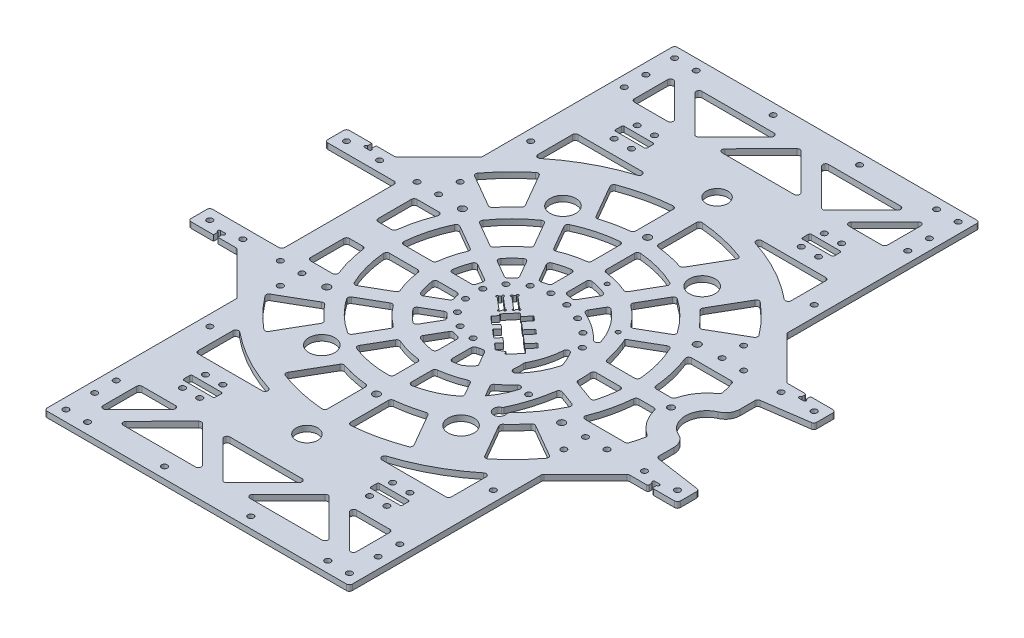
from build123d import *

# Parameters (mm, degrees)
EXTRUDE_2_OUTLINE_R   = 135
EXTRUDE_2_OUTLINE_R_2 = 2
EXTRUDE_2_DEPTH       = 4
SKETCH_7_R            = 2.5
SKETCH_7_R_2          = 1.5
CUT_EXTRUDE_3_DEPTH   = 191.960728947
EXTRUDE_START         = -4
SKETCH_8_R            = 135
EXTRUDE_3_DEPTH       = 4
SKETCH_9_R            = 0.75
SKETCH_9_R_2          = 2
SKETCH_9_R_3          = 2.2
SKETCH_9_W            = 22
SKETCH_9_H            = 6
SKETCH_9_W_2          = 3
SKETCH_9_H_2          = 5
SKETCH_9_W_3          = 50
SKETCH_9_H_3          = 80
CUT_EXTRUDE_4_DEPTH   = 278.267019315
FILLET_1_R            = 0.5
SKETCH_10_R           = 9
SKETCH_10_R_2         = 1
CUT_EXTRUDE_5_DEPTH   = 278.267019315
SKETCH_12_W           = 10
SKETCH_12_H           = 55
SKETCH_12_W_2         = 30
SKETCH_12_H_2         = 10
SKETCH_12_W_3         = 55
EXTRUDE_2_2_DEPTH     = 4
SKETCH_22_R           = 7.5
SKETCH_22_R_2         = 4
CUT_EXTRUDE_10_DEPTH  = 278.267019315
FILLET_2_R            = 2
FILLET_3_R            = 1
FILLET_5_R            = 2


with BuildPart() as part:
    # Extrude 2: read off the stored shape, not the designer's step
    # Extrude 2 outline → Extrude 2 (new body)
    with BuildSketch(Plane(origin=(0, 0, 0), x_dir=(1, 0, 0), z_dir=(0, 1, 0))):
        Circle(EXTRUDE_2_OUTLINE_R)
        with Locations((-11.714860956, -24.326159433)):
            Circle(EXTRUDE_2_OUTLINE_R_2, mode=Mode.SUBTRACT)
        with Locations((-21.109450027, -16.83422465)):
            Circle(EXTRUDE_2_OUTLINE_R_2, mode=Mode.SUBTRACT)
        with Locations((-26.323053629, -6.008065217)):
            Circle(EXTRUDE_2_OUTLINE_R_2, mode=Mode.SUBTRACT)
        with Locations((53.170264489, -41.583325675)):
            Circle(EXTRUDE_2_OUTLINE_R_2, mode=Mode.SUBTRACT)
        with Locations((0, -27)):
            Circle(EXTRUDE_2_OUTLINE_R_2, mode=Mode.SUBTRACT)
        with Locations((-26.323053629, 6.008065217)):
            Circle(EXTRUDE_2_OUTLINE_R_2, mode=Mode.SUBTRACT)
        with Locations((-21.109450027, 16.83422465)):
            Circle(EXTRUDE_2_OUTLINE_R_2, mode=Mode.SUBTRACT)
        with Locations((-11.714860956, 24.326159433)):
            Circle(EXTRUDE_2_OUTLINE_R_2, mode=Mode.SUBTRACT)
        with Locations((0, 27)):
            Circle(EXTRUDE_2_OUTLINE_R_2, mode=Mode.SUBTRACT)
        with Locations((12.54040261, 25.523692772)):
            Circle(EXTRUDE_2_OUTLINE_R_2, mode=Mode.SUBTRACT)
        with Locations((24.405378999, 21.203563613)):
            Circle(EXTRUDE_2_OUTLINE_R_2, mode=Mode.SUBTRACT)
        with Locations((43.695920987, 5.163960602)):
            Circle(EXTRUDE_2_OUTLINE_R_2, mode=Mode.SUBTRACT)
        with Locations((34.975533599, 14.296102982)):
            Circle(EXTRUDE_2_OUTLINE_R_2, mode=Mode.SUBTRACT)
    extrude(amount=EXTRUDE_2_DEPTH)

    # 草图7 → 切除-拉伸3 (cut, through all)
    with BuildSketch(Plane(origin=(0, 4, 0), x_dir=(1, 0, 0), z_dir=(0, 1, 0))):
        with Locations(Location((81.622894307, 47.125, 0), (0, 0, 270))):
            Circle(SKETCH_7_R)
        with Locations(Location((81.622894307, -47.125, 0), (0, 0, 270))):
            Circle(SKETCH_7_R)
        with Locations(Location((0, -94.25, 0), (0, 0, 270))):
            Circle(SKETCH_7_R)
        with Locations(Location((-81.622894307, -47.125, 0), (0, 0, 270))):
            Circle(SKETCH_7_R)
        with Locations(Location((-81.622894307, 47.125, 0), (0, 0, 270))):
            Circle(SKETCH_7_R)
        with Locations(Location((0, 94.25, 0), (0, 0, 270))):
            Circle(SKETCH_7_R)
        with Locations(Location((13.976228436, 52.15999462, 0), (0, 0, 270))):
            Circle(SKETCH_7_R_2)
        with Locations(Location((46.765371804, 27, 0), (0, 0, 270))):
            Circle(SKETCH_7_R_2)
        Polygon((1.215567157, 4.509929222), (-5.400270312, -3.253491067), (20.858357137, -25.630588388), (27.474194606, -17.867168099), align=None)
        Polygon((-10.201227386, 14.23910197), (-12.147061936, 11.955743062), (-3.013626301, 4.172404863), (-1.067791752, 6.455763772), align=None)
        Polygon((-7.68362922, -1.307656517), (-5.737794671, 0.975702391), (-14.871230305, 8.75904059), (-16.817064855, 6.475681681), align=None)
    extrude(amount=-CUT_EXTRUDE_3_DEPTH, mode=Mode.SUBTRACT)

    # 草图8 → 凸台-拉伸3 (add)
    with BuildSketch(Plane(origin=(0, 4, 0), x_dir=(1, 0, 0), z_dir=(0, 1, 0)).offset(EXTRUDE_START)):
        Polygon((170, 55), (170, -55), (136, -55), (106, -85), (106, -219), (-106, -219), (-106, -85), (-136, -55), (-170, -55), (-170, 55), (-136, 55), (-106, 85), (-106, 219), (106, 219), (106, 85), (136, 55), align=None)
        Circle(SKETCH_8_R, mode=Mode.SUBTRACT)
    extrude(amount=EXTRUDE_3_DEPTH)

    # 草图9 → 切除-拉伸4 (cut, through all)
    with BuildSketch(Plane(origin=(0, 4, 0), x_dir=(1, 0, 0), z_dir=(0, 1, 0))):
        with Locations((-3.013626301, 4.172404863)):
            Circle(SKETCH_9_R)
        with Locations((-1.067791752, 6.455763772)):
            Circle(SKETCH_9_R)
        with Locations((-10.201227386, 14.23910197)):
            Circle(SKETCH_9_R)
        with Locations((-12.147061936, 11.955743062)):
            Circle(SKETCH_9_R)
        with Locations((-14.871230305, 8.75904059)):
            Circle(SKETCH_9_R)
        with Locations((-16.817064855, 6.475681681)):
            Circle(SKETCH_9_R)
        with Locations((-5.737794671, 0.975702391)):
            Circle(SKETCH_9_R)
        with Locations((-7.68362922, -1.307656517)):
            Circle(SKETCH_9_R)
        with Locations(Location((162.5, 47.5, 0), (0, 0, 270))):
            Circle(SKETCH_9_R_2)
        with Locations(Location((139.5, 47.5, 0), (0, 0, 270))):
            Circle(SKETCH_9_R_2)
        with Locations(Location((98.5, 62.5, 0), (0, 0, 270))):
            Circle(SKETCH_9_R_2)
        with Locations(Location((98.5, 47.5, 0), (0, 0, 270))):
            Circle(SKETCH_9_R_2)
        with Locations(Location((113.5, 47.5, 0), (0, 0, 270))):
            Circle(SKETCH_9_R_2)
        with Locations(Location((162.5, -47.5, 0), (0, 0, 90))):
            Circle(SKETCH_9_R_2)
        with Locations(Location((139.5, -47.5, 0), (0, 0, 90))):
            Circle(SKETCH_9_R_2)
        with Locations(Location((113.5, -47.5, 0), (0, 0, 90))):
            Circle(SKETCH_9_R_2)
        with Locations(Location((98.5, -47.5, 0), (0, 0, 90))):
            Circle(SKETCH_9_R_2)
        with Locations(Location((98.5, -62.5, 0), (0, 0, 90))):
            Circle(SKETCH_9_R_2)
        with Locations(Location((-98.5, -62.5, 0), (0, 0, 270))):
            Circle(SKETCH_9_R_2)
        with Locations(Location((-98.5, -47.5, 0), (0, 0, 270))):
            Circle(SKETCH_9_R_2)
        with Locations(Location((-113.5, -47.5, 0), (0, 0, 270))):
            Circle(SKETCH_9_R_2)
        with Locations(Location((-139.5, -47.5, 0), (0, 0, 270))):
            Circle(SKETCH_9_R_2)
        with Locations(Location((-162.5, -47.5, 0), (0, 0, 270))):
            Circle(SKETCH_9_R_2)
        with Locations(Location((-113.5, 47.5, 0), (0, 0, 90))):
            Circle(SKETCH_9_R_2)
        with Locations(Location((-98.5, 47.5, 0), (0, 0, 90))):
            Circle(SKETCH_9_R_2)
        with Locations(Location((-98.5, 62.5, 0), (0, 0, 90))):
            Circle(SKETCH_9_R_2)
        with Locations(Location((-139.5, 47.5, 0), (0, 0, 90))):
            Circle(SKETCH_9_R_2)
        with Locations(Location((-162.5, 47.5, 0), (0, 0, 90))):
            Circle(SKETCH_9_R_2)
        with Locations(Location((110.5, 0, 0), (0, 0, 270))):
            Circle(SKETCH_9_R_3)
        with Locations(Location((71, 158, 0), (0, 0, 270))):
            Circle(SKETCH_9_R_2)
        with Locations(Location((59, 158, 0), (0, 0, 270))):
            Circle(SKETCH_9_R_2)
        with Locations(Location((83.5, 211.5, 0), (0, 0, 270))):
            Circle(SKETCH_9_R_2)
        with Locations(Location((98.5, 211.5, 0), (0, 0, 270))):
            Circle(SKETCH_9_R_2)
        with Locations(Location((98.5, 191.5, 0), (0, 0, 270))):
            Circle(SKETCH_9_R_2)
        with Locations(Location((98.5, 176.5, 0), (0, 0, 270))):
            Circle(SKETCH_9_R_2)
        with Locations(Location((98.5, 111.5, 0), (0, 0, 270))):
            Circle(SKETCH_9_R_2)
        with Locations(Location((98.5, -111.5, 0), (0, 0, 90))):
            Circle(SKETCH_9_R_2)
        with Locations(Location((98.5, -176.5, 0), (0, 0, 90))):
            Circle(SKETCH_9_R_2)
        with Locations(Location((98.5, -191.5, 0), (0, 0, 90))):
            Circle(SKETCH_9_R_2)
        with Locations(Location((98.5, -211.5, 0), (0, 0, 90))):
            Circle(SKETCH_9_R_2)
        with Locations(Location((83.5, -211.5, 0), (0, 0, 90))):
            Circle(SKETCH_9_R_2)
        with Locations(Location((-98.5, 111.5, 0), (0, 0, 90))):
            Circle(SKETCH_9_R_2)
        with Locations(Location((-98.5, 176.5, 0), (0, 0, 90))):
            Circle(SKETCH_9_R_2)
        with Locations(Location((-98.5, 191.5, 0), (0, 0, 90))):
            Circle(SKETCH_9_R_2)
        with Locations(Location((-98.5, 211.5, 0), (0, 0, 90))):
            Circle(SKETCH_9_R_2)
        with Locations(Location((-83.5, 211.5, 0), (0, 0, 90))):
            Circle(SKETCH_9_R_2)
        with Locations(Location((-83.5, -211.5, 0), (0, 0, 270))):
            Circle(SKETCH_9_R_2)
        with Locations(Location((-98.5, -211.5, 0), (0, 0, 270))):
            Circle(SKETCH_9_R_2)
        with Locations(Location((-98.5, -191.5, 0), (0, 0, 270))):
            Circle(SKETCH_9_R_2)
        with Locations(Location((-98.5, -176.5, 0), (0, 0, 270))):
            Circle(SKETCH_9_R_2)
        with Locations(Location((-98.5, -111.5, 0), (0, 0, 270))):
            Circle(SKETCH_9_R_2)
        with Locations(Location((59, 142, 0), (0, 0, 270))):
            Circle(SKETCH_9_R_2)
        with Locations(Location((71, 142, 0), (0, 0, 270))):
            Circle(SKETCH_9_R_2)
        with Locations(Location((-59, 142, 0), (0, 0, 90))):
            Circle(SKETCH_9_R_2)
        with Locations(Location((-71, 142, 0), (0, 0, 90))):
            Circle(SKETCH_9_R_2)
        with Locations(Location((-71, 158, 0), (0, 0, 90))):
            Circle(SKETCH_9_R_2)
        with Locations(Location((-59, 158, 0), (0, 0, 90))):
            Circle(SKETCH_9_R_2)
        with Locations(Location((71, -142, 0), (0, 0, 90))):
            Circle(SKETCH_9_R_2)
        with Locations(Location((59, -142, 0), (0, 0, 90))):
            Circle(SKETCH_9_R_2)
        with Locations(Location((71, -158, 0), (0, 0, 90))):
            Circle(SKETCH_9_R_2)
        with Locations(Location((59, -158, 0), (0, 0, 90))):
            Circle(SKETCH_9_R_2)
        with Locations(Location((-59, -158, 0), (0, 0, 270))):
            Circle(SKETCH_9_R_2)
        with Locations(Location((-71, -158, 0), (0, 0, 270))):
            Circle(SKETCH_9_R_2)
        with Locations(Location((-71, -142, 0), (0, 0, 270))):
            Circle(SKETCH_9_R_2)
        with Locations(Location((-59, -142, 0), (0, 0, 270))):
            Circle(SKETCH_9_R_2)
        with Locations(Location((30, 211.5, 0), (0, 0, 270))):
            Circle(SKETCH_9_R_2)
        with Locations(Location((-30, 211.5, 0), (0, 0, 90))):
            Circle(SKETCH_9_R_2)
        with Locations(Location((-30, -211.5, 0), (0, 0, 270))):
            Circle(SKETCH_9_R_2)
        with Locations(Location((30, -211.5, 0), (0, 0, 90))):
            Circle(SKETCH_9_R_2)
        Polygon((16.391664776, 0.117201019), (5.559852449, -12.593496905), (4.30400505, -11.523287903), (1.385253225, -14.948326266), (7.093650497, -19.81291264), (10.012402321, -16.387874277), (8.756554921, -15.317665275), (19.588367248, -2.606967351), align=None)
        Polygon((-4.296646839, -4.193977766), (-7.215398664, -7.619016129), (-1.507001392, -12.483602503), (1.411750432, -9.05856414), (0.155903032, -7.988355138), (10.987715359, 4.722342786), (7.791012887, 7.446511156), (-3.04079944, -5.264186768), align=None)
        Polygon((17.813878592, -23.036142322), (28.645690918, -10.325444398), (25.448988446, -7.601276028), (14.61717612, -20.311973952), (13.36132872, -19.24176495), (10.442576896, -22.666803313), (16.150974167, -27.531389687), (19.069725992, -24.106351324), align=None)
        with BuildLine():
            Line((170, 40), (135.5, 35))
            Line((135.5, 35), (135.5, 22.912878475))
            ThreePointArc((135.5, 22.912878475), (133.866600265, 17.4356529), (129.5, 13.747727085))
            ThreePointArc((129.5, 13.747727085), (120.5, 0), (129.5, -13.747727085))
            ThreePointArc((129.5, -13.747727085), (133.866600265, -17.4356529), (135.5, -22.912878475))
            Line((135.5, -22.912878475), (135.5, -35))
            Line((135.5, -35), (170, -40))
            Line((170, -40), (170, 40))
        make_face()
        with Locations((65, 150)):
            Rectangle(SKETCH_9_W, SKETCH_9_H)
        with Locations((-150.95, -52.5)):
            Rectangle(SKETCH_9_W_2, SKETCH_9_H_2)
        with Locations((65, -150)):
            Rectangle(SKETCH_9_W, SKETCH_9_H)
        with Locations((150.95, 52.5)):
            Rectangle(SKETCH_9_W_2, SKETCH_9_H_2)
        with Locations((150.95, -52.5)):
            Rectangle(SKETCH_9_W_2, SKETCH_9_H_2)
        with Locations((-150.95, 52.5)):
            Rectangle(SKETCH_9_W_2, SKETCH_9_H_2)
        with Locations((-145, 0)):
            Rectangle(SKETCH_9_W_3, SKETCH_9_H_3)
        with Locations((-65, 150)):
            Rectangle(SKETCH_9_W, SKETCH_9_H)
        with Locations((-65, -150)):
            Rectangle(SKETCH_9_W, SKETCH_9_H)
    extrude(amount=-CUT_EXTRUDE_4_DEPTH, mode=Mode.SUBTRACT)

    # 圆角1
    fillet_1_edges = [part.edges().sort_by_distance(p)[0] for p in [
        (1.215567157, 2, -4.509929222),
        (27.474194606, 2, 17.867168099),
        (20.858357137, 2, 25.630588388),
        (-5.400270312, 2, 3.253491067),
        (19.588367248, 2, 2.606967351),
        (1.385253225, 2, 14.948326266),
        (16.391664776, 2, -0.117201019),
        (7.093650497, 2, 19.81291264),
        (28.645690918, 2, 10.325444398),
        (10.442576896, 2, 22.666803313),
        (25.448988446, 2, 7.601276028),
        (16.150974167, 2, 27.531389687),
        (10.987715359, 2, -4.722342786),
        (7.791012887, 2, -7.446511156),
        (-1.507001392, 2, 12.483602503),
        (-7.215398664, 2, 7.619016129),
    ]]
    fillet(fillet_1_edges, radius=FILLET_1_R)

    # 草图10 → 切除-拉伸5 (cut, through all)
    with BuildSketch(Plane(origin=(0, 4, 0), x_dir=(1, 0, 0), z_dir=(0, 1, 0))):
        with Locations(Location((-48.375, 83.787957816, 0), (0, 0, 270))):
            Circle(SKETCH_10_R)
        with Locations(Location((48.375, 83.787957816, 0), (0, 0, 270))):
            Circle(SKETCH_10_R)
        with Locations(Location((48.375, -83.787957816, 0), (0, 0, 270))):
            Circle(SKETCH_10_R)
        with Locations(Location((-48.375, -83.787957816, 0), (0, 0, 270))):
            Circle(SKETCH_10_R)
        with Locations((149.45, 51)):
            Circle(SKETCH_10_R_2)
        with Locations((152.45, 51)):
            Circle(SKETCH_10_R_2)
        with Locations((152.45, -51)):
            Circle(SKETCH_10_R_2)
        with Locations((149.45, -51)):
            Circle(SKETCH_10_R_2)
        with Locations((-149.45, -51)):
            Circle(SKETCH_10_R_2)
        with Locations((-152.45, -51)):
            Circle(SKETCH_10_R_2)
        with Locations((-152.45, 51)):
            Circle(SKETCH_10_R_2)
        with Locations((-149.45, 51)):
            Circle(SKETCH_10_R_2)
        with BuildLine():
            ThreePointArc((54.807599699, 21.843237289), (-58.035185112, 10.626254705), (43.512352912, -39.845641469))
            ThreePointArc((43.512352912, -39.845641469), (45.966882899, -39.452635002), (46.908234228, -41.753293433))
            ThreePointArc((46.908234228, -41.753293433), (35.725023116, -61.49758579), (16.859238941, -74.106450882))
            ThreePointArc((16.859238941, -74.106450882), (-26.987401916, -76.117709483), (-63.833064957, -52.264613442))
            ThreePointArc((-63.833064957, -52.264613442), (6.543748569, 82.240071466), (54.764925772, -61.701320125))
            ThreePointArc((54.764925772, -61.701320125), (52.225261686, -61.796437344), (51.642704378, -59.322661297))
            ThreePointArc((51.642704378, -59.322661297), (61.837427116, -19.075529749), (54.807599699, 21.843237289))
        make_face()
        with BuildLine():
            ThreePointArc((48.483149933, 7.098180936), (-40.861999704, 27.042503216), (12.415555235, -47.400991426))
            ThreePointArc((12.415555235, -47.400991426), (18.681796727, -41.317756254), (22.242880009, -33.343408729))
            ThreePointArc((22.242880009, -33.343408729), (22.008638881, -31.855621383), (20.802882397, -30.953107455))
            ThreePointArc((20.802882397, -30.953107455), (14.460540203, -30.135222653), (8.118198009, -30.953107455))
            ThreePointArc((8.118198009, -30.953107455), (-31.737197725, -4.092710662), (4.1e-08, 32))
            ThreePointArc((4.1e-08, 32), (6.898084414, 31.595361796), (13.701550903, 30.386997681))
            ThreePointArc((13.701550903, 30.386997681), (33.185077819, 21.868055327), (48.483149933, 7.098180936))
        make_face()
        with BuildLine():
            ThreePointArc((31.462480379, -37.564775101), (32.728244708, -30.923894341), (32.618689385, -24.164348924))
            ThreePointArc((32.618689385, -24.164348924), (37.70981937, -10.922222356), (38.876667523, 3.216801159))
            ThreePointArc((38.876667523, 3.216801159), (43.832931918, -4.268743283), (47.373891096, -12.518563914))
            ThreePointArc((47.373891096, -12.518563914), (41.359660788, -26.275053939), (31.462480379, -37.564775101))
        make_face()
    extrude(amount=-CUT_EXTRUDE_5_DEPTH, mode=Mode.SUBTRACT)

    # 草图12 → Extrude 2 2 (add)
    with BuildSketch(Plane(origin=(0, 4, 0), x_dir=(1, 0, 0), z_dir=(0, 1, 0))):
        with Locations((0, 56.5)):
            Rectangle(SKETCH_12_W, SKETCH_12_H)
        Polygon((19.700243076, 24.121821929), (46.330127019, 70.246133918), (37.669872981, 75.246133918), (11.039989038, 29.121821929), align=None)
        Polygon((50.997422612, 23.669872981), (75.246133918, 37.669872981), (70.246133918, 46.330127019), (45.997422612, 32.330127019), align=None)
        with Locations((69, 0)):
            Rectangle(SKETCH_12_W_2, SKETCH_12_H_2)
        Polygon((10.798129487, -28.702908898), (37.669872981, -75.246133918), (46.330127019, -70.246133918), (19.458383525, -23.702908898), align=None)
        with Locations((0, -56.5)):
            Rectangle(SKETCH_12_W, SKETCH_12_H)
        Polygon((-18.792378281, -22.549353978), (-46.330127019, -70.246133918), (-37.669872981, -75.246133918), (-10.132124243, -27.549353978), align=None)
        Polygon((-27.61473671, -10.169872981), (-75.246133918, -37.669872981), (-70.246133918, -46.330127019), (-22.61473671, -18.830127019), align=None)
        with Locations((-56.5, 0)):
            Rectangle(SKETCH_12_W_3, SKETCH_12_H_2)
        Polygon((-22.61473671, 18.830127019), (-70.246133918, 46.330127019), (-75.246133918, 37.669872981), (-27.61473671, 10.169872981), align=None)
        Polygon((-10.169872981, 27.61473671), (-37.669872981, 75.246133918), (-46.330127019, 70.246133918), (-18.830127019, 22.61473671), align=None)
        Polygon((49.033300806, -23.167550844), (77.224079429, -33.428155143), (80.644280863, -24.031228935), (52.453502239, -13.770624636), align=None)
    extrude(amount=-EXTRUDE_2_2_DEPTH)

    # 草图22 → 切除-拉伸10 (cut, through all)
    with BuildSketch(Plane(origin=(0, 4, 0), x_dir=(1, 0, 0), z_dir=(0, 1, 0))):
        with Locations(Location((0, 142.5, 0), (0, 0, 270))):
            Circle(SKETCH_22_R)
        with Locations((53.427287802, -62.205505529)):
            Circle(SKETCH_22_R_2)
        with Locations(Location((0, -142.5, 0), (0, 0, 90))):
            Circle(SKETCH_22_R)
        with BuildLine():
            Line((-105, 10), (-105, 37))
            Line((-105, 37), (-84.777650357, 37))
            ThreePointArc((-84.777650357, 37), (-89.393014876, 23.77265007), (-91.957870789, 10))
            Line((-91.957870789, 10), (-105, 10))
        make_face()
        with BuildLine():
            Line((29.77741647, 87.575998244), (44.996710059, 113.936587995))
            ThreePointArc((44.996710059, 113.936587995), (26.821507042, 119.527640151), (8, 122.238496391))
            Line((8, 122.238496391), (8, 92.153404712))
            ThreePointArc((8, 92.153404712), (19.026861572, 90.521978208), (29.77741647, 87.575998244))
        make_face()
        with BuildLine():
            Line((92.305200287, 6), (106.106123087, 6))
            ThreePointArc((106.106123087, 6), (110.923432142, 17.204427113), (119.802583026, 25.565427834))
            ThreePointArc((119.802583026, 25.565427834), (118.42869478, 31.319231357), (116.778636745, 37))
            Line((116.778636745, 37), (84.777650357, 37))
            ThreePointArc((84.777650357, 37), (89.887896838, 21.826955857), (92.305200287, 6))
        make_face()
        with BuildLine():
            Line((72.812278368, 57.049295515), (98.989039715, 72.162455725))
            ThreePointArc((98.989039715, 72.162455725), (88.384342976, 84.820150417), (76.173624595, 95.936587995))
            Line((76.173624595, 95.936587995), (60.954331006, 69.575998244))
            ThreePointArc((60.954331006, 69.575998244), (67.175933311, 63.589653119), (72.812278368, 57.049295515))
        make_face()
        with BuildLine():
            Line((116.778636745, -37), (84.777650357, -37))
            ThreePointArc((84.777650357, -37), (89.887896838, -21.826955857), (92.305200287, -6))
            Line((92.305200287, -6), (106.106123087, -6))
            ThreePointArc((106.106123087, -6), (110.923432142, -17.204427113), (119.802583026, -25.565427834))
            ThreePointArc((119.802583026, -25.565427834), (118.42869478, -31.319231357), (116.778636745, -37))
        make_face()
        with BuildLine():
            Line((25.811818998, 132), (88, 132))
            Line((88, 132), (88, 101.716517833))
            ThreePointArc((88, 101.716517833), (58.885947891, 120.92433643), (25.811818998, 132))
        make_face()
        with BuildLine():
            Line((-88, 132), (-88, 101.716517833))
            ThreePointArc((-88, 101.716517833), (-58.885947891, 120.92433643), (-25.811818998, 132))
            Line((-25.811818998, 132), (-88, 132))
        make_face()
        with BuildLine():
            Line((-60.954331006, 69.575998244), (-76.173624595, 95.936587995))
            ThreePointArc((-76.173624595, 95.936587995), (-88.384342976, 84.820150417), (-98.989039715, 72.162455725))
            Line((-98.989039715, 72.162455725), (-72.812278368, 57.049295515))
            ThreePointArc((-72.812278368, 57.049295515), (-67.175933311, 63.589653119), (-60.954331006, 69.575998244))
        make_face()
        with BuildLine():
            Line((-8, 92.153404712), (-8, 122.238496391))
            ThreePointArc((-8, 122.238496391), (-26.821507042, 119.527640151), (-44.996710059, 113.936587995))
            Line((-44.996710059, 113.936587995), (-29.77741647, 87.575998244))
            ThreePointArc((-29.77741647, 87.575998244), (-19.026861572, 90.521978208), (-8, 92.153404712))
        make_face()
        with BuildLine():
            Line((72.812278368, -57.049295515), (98.989039715, -72.162455725))
            ThreePointArc((98.989039715, -72.162455725), (88.384342976, -84.820150417), (76.173624595, -95.936587995))
            Line((76.173624595, -95.936587995), (60.954331006, -69.575998244))
            ThreePointArc((60.954331006, -69.575998244), (67.175933311, -63.589653119), (72.812278368, -57.049295515))
        make_face()
        with BuildLine():
            Line((-29.77741647, -87.575998244), (-44.996710059, -113.936587995))
            ThreePointArc((-44.996710059, -113.936587995), (-26.821507042, -119.527640151), (-8, -122.238496391))
            Line((-8, -122.238496391), (-8, -92.153404712))
            ThreePointArc((-8, -92.153404712), (-19.026861572, -90.521978208), (-29.77741647, -87.575998244))
        make_face()
        with BuildLine():
            Line((-72.812278368, -57.049295515), (-98.989039715, -72.162455725))
            ThreePointArc((-98.989039715, -72.162455725), (-88.384342976, -84.820150417), (-76.173624595, -95.936587995))
            Line((-76.173624595, -95.936587995), (-60.954331006, -69.575998244))
            ThreePointArc((-60.954331006, -69.575998244), (-67.175933311, -63.589653119), (-72.812278368, -57.049295515))
        make_face()
        with BuildLine():
            Line((-25.811818998, -132), (-88, -132))
            Line((-88, -132), (-88, -101.716517833))
            ThreePointArc((-88, -101.716517833), (-58.885947891, -120.92433643), (-25.811818998, -132))
        make_face()
        with BuildLine():
            Line((88, -132), (88, -101.716517833))
            ThreePointArc((88, -101.716517833), (58.885947891, -120.92433643), (25.811818998, -132))
            Line((25.811818998, -132), (88, -132))
        make_face()
        with BuildLine():
            Line((8, -92.153404712), (8, -122.238496391))
            ThreePointArc((8, -122.238496391), (26.821507042, -119.527640151), (44.996710059, -113.936587995))
            Line((44.996710059, -113.936587995), (29.77741647, -87.575998244))
            ThreePointArc((29.77741647, -87.575998244), (19.026861572, -90.521978208), (8, -92.153404712))
        make_face()
        with BuildLine():
            Line((-91.957870789, -10), (-105, -10))
            Line((-105, -10), (-105, -37))
            Line((-105, -37), (-84.777650357, -37))
            ThreePointArc((-84.777650357, -37), (-89.393014876, -23.77265007), (-91.957870789, -10))
        make_face()
        Polygon((88, 201), (88, 171), (58.115045246, 171), align=None)
        Polygon((73.884954754, 201), (14.115045246, 201), (44, 171), align=None)
        Polygon((-29.884954754, 171), (29.884954754, 171), (0, 201), align=None)
        Polygon((-44, 171), (-73.884954754, 201), (-14.115045246, 201), align=None)
        Polygon((-58.115045246, 171), (-88, 201), (-88, 171), align=None)
        Polygon((-29.884954754, -171), (0, -201), (29.884954754, -171), align=None)
        Polygon((-88, -201), (-88, -171), (-58.115045246, -171), align=None)
        Polygon((-73.884954754, -201), (-14.115045246, -201), (-44, -171), align=None)
        Polygon((44, -171), (73.884954754, -201), (14.115045246, -201), align=None)
        Polygon((58.115045246, -171), (88, -201), (88, -171), align=None)
    extrude(amount=-CUT_EXTRUDE_10_DEPTH, mode=Mode.SUBTRACT)

    # 圆角2
    fillet_2_edges = [part.edges().sort_by_distance(p)[0] for p in [
        (106, 2, -85),
        (106, 2, -219),
        (-106, 2, -219),
        (-106, 2, -85),
        (-136, 2, -55),
        (-170, 2, -55),
        (-170, 2, 55),
        (-136, 2, 55),
        (-106, 2, 85),
        (-106, 2, 219),
        (106, 2, 219),
        (106, 2, 85),
        (136, 2, 55),
        (170, 2, 55),
        (170, 2, -55),
        (136, 2, -55),
        (52.07026489, 2, 58.442728786),
        (56.709392105, 2, 59.919069144),
        (170, 2, -40),
        (170, 2, 40),
        (135.5, 2, 35),
        (135.5, 2, -35),
        (-170, 2, 40),
        (-170, 2, -40),
    ]]
    fillet(fillet_2_edges, radius=FILLET_2_R)

    # 圆角3
    fillet_3_edges = [part.edges().sort_by_distance(p)[0] for p in [
        (76, 2, -153),
        (76, 2, -147),
        (54, 2, -147),
        (54, 2, -153),
        (-54, 2, 153),
        (-76, 2, 153),
        (-76, 2, 147),
        (-54, 2, 147),
        (149.45, 2, -55),
        (152.45, 2, -55),
        (76, 2, 153),
        (54, 2, 153),
        (54, 2, 147),
        (76, 2, 147),
        (-76, 2, -153),
        (-54, 2, -153),
        (-54, 2, -147),
        (-76, 2, -147),
        (149.45, 2, 55),
        (152.45, 2, 55),
    ]]
    fillet(fillet_3_edges, radius=FILLET_3_R)

    # 圆角5
    fillet_5_edges = [part.edges().sort_by_distance(p)[0] for p in [
        (47.373891096, 2, 12.518563914),
        (31.462480379, 2, 37.564775101),
        (32.618689385, 2, 24.164348924),
        (38.876667523, 2, -3.216801159),
        (48.483149933, 2, -7.098180936),
        (5, 2, -58.787753827),
        (-5, 2, -58.787753827),
        (-5, 2, -31.606961259),
        (-5, 2, -48.744230428),
        (-5, 2, -82.34834546),
        (5, 2, -31.787753768),
        (5, 2, -48.744230428),
        (5, 2, -82.34834546),
        (48.411688245, 2, -33.724003932),
        (68.815759128, 2, -45.504299749),
        (73.815759128, 2, -36.844045711),
        (28.702242233, 2, -39.713741838),
        (20.041988195, 2, -44.713741838),
        (36.844045711, 2, -73.815759128),
        (25.063749894, 2, -53.411688245),
        (11.990804111, 2, -30.768681943),
        (33.724003932, 2, -48.411688245),
        (21.836777721, 2, -27.822408486),
        (45.504299749, 2, -68.815759128),
        (31.877025819, 2, 65.212628312),
        (33.724003932, 2, 48.411688245),
        (11.712538572, 2, 30.286711892),
        (25.063749894, 2, 53.411688245),
        (61.393933446, 2, 5),
        (59.856203068, 2, -5),
        (82.34834546, 2, -5),
        (82.34834546, 2, 5),
        (-5, 2, 78.543952843),
        (5, 2, 77.392922847),
        (5, 2, 31.606961259),
        (5, 2, 48.744230428),
        (5, 2, 58.787753827),
        (-5, 2, 31.606961259),
        (-5, 2, 48.744230428),
        (-5, 2, 58.787753827),
        (-45.232822915, 2, 68.345547458),
        (-36.311139386, 2, 72.892738297),
        (-11.47335361, 2, 29.872431386),
        (-20.041988195, 2, 44.713741838),
        (-25.063749894, 2, 53.411688245),
        (-20.133607648, 2, 24.872431386),
        (-28.702242233, 2, 39.713741838),
        (-33.724003932, 2, 48.411688245),
        (-24.872431386, 2, 20.133607648),
        (-39.713741838, 2, 28.702242233),
        (-68.815759128, 2, 45.504299749),
        (-48.411688245, 2, 33.724003932),
        (-29.872431386, 2, 11.47335361),
        (-53.411688245, 2, 25.063749894),
        (-44.713741838, 2, 20.041988195),
        (-73.815759128, 2, 36.844045711),
        (-31.606961259, 2, 5),
        (-48.744230428, 2, 5),
        (-82.34834546, 2, 5),
        (-58.787753827, 2, 5),
        (-31.606961259, 2, -5),
        (-58.787753827, 2, -5),
        (-48.744230428, 2, -5),
        (-82.34834546, 2, -5),
        (-29.872431386, 2, -11.47335361),
        (-44.713741838, 2, -20.041988195),
        (-73.815759128, 2, -36.844045711),
        (-53.411688245, 2, -25.063749894),
        (-24.872431386, 2, -20.133607648),
        (-48.411688245, 2, -33.724003932),
        (-39.713741838, 2, -28.702242233),
        (-68.815759128, 2, -45.504299749),
        (-20.133607648, 2, -24.872431386),
        (-28.702242233, 2, -39.713741838),
        (-45.504299749, 2, -68.815759128),
        (-33.724003932, 2, -48.411688245),
        (-11.47335361, 2, -29.872431386),
        (-25.063749894, 2, -53.411688245),
        (-20.041988195, 2, -44.713741838),
        (-36.844045711, 2, -73.815759128),
        (61.142133613, 2, 27.574805557),
        (61.892816049, 2, 17.206253894),
        (79.092233279, 2, 23.466329813),
        (75.672031846, 2, 32.863256021),
        (60.954331006, 2, 69.575998244),
        (72.812278368, 2, 57.049295515),
        (98.989039715, 2, 72.162455725),
        (76.173624595, 2, 95.936587995),
        (58.115045246, 2, -171),
        (88, 2, -201),
        (88, 2, -171),
        (76.173624595, 2, -95.936587995),
        (98.989039715, 2, -72.162455725),
        (72.812278368, 2, -57.049295515),
        (60.954331006, 2, -69.575998244),
        (-88, 2, 101.716517833),
        (-25.811818998, 2, 132),
        (-88, 2, 132),
        (73.884954754, 2, -201),
        (44, 2, -171),
        (14.115045246, 2, -201),
        (-72.812278368, 2, 57.049295515),
        (-60.954331006, 2, 69.575998244),
        (-76.173624595, 2, 95.936587995),
        (-98.989039715, 2, 72.162455725),
        (-8, 2, 122.238496391),
        (-44.996710059, 2, 113.936587995),
        (-29.77741647, 2, 87.575998244),
        (-8, 2, 92.153404712),
        (-84.777650357, 2, -37),
        (-91.957870789, 2, -10),
        (-105, 2, -10),
        (-105, 2, -37),
        (88, 2, -101.716517833),
        (25.811818998, 2, -132),
        (88, 2, -132),
        (119.802583026, 2, -25.565427834),
        (106.106123087, 2, -6),
        (92.305200287, 2, -6),
        (84.777650357, 2, -37),
        (116.778636745, 2, -37),
        (119.802583026, 2, 25.565427834),
        (116.778636745, 2, 37),
        (84.777650357, 2, 37),
        (92.305200287, 2, 6),
        (106.106123087, 2, 6),
        (-8, 2, -92.153404712),
        (-29.77741647, 2, -87.575998244),
        (-44.996710059, 2, -113.936587995),
        (-8, 2, -122.238496391),
        (-98.989039715, 2, -72.162455725),
        (-76.173624595, 2, -95.936587995),
        (-60.954331006, 2, -69.575998244),
        (-72.812278368, 2, -57.049295515),
        (-25.811818998, 2, -132),
        (-88, 2, -101.716517833),
        (-88, 2, -132),
        (14.115045246, 2, 201),
        (44, 2, 171),
        (73.884954754, 2, 201),
        (58.115045246, 2, 171),
        (88, 2, 171),
        (88, 2, 201),
        (-58.115045246, 2, 171),
        (-88, 2, 201),
        (-88, 2, 171),
        (-73.884954754, 2, 201),
        (-44, 2, 171),
        (-14.115045246, 2, 201),
        (8, 2, 92.153404712),
        (29.77741647, 2, 87.575998244),
        (44.996710059, 2, 113.936587995),
        (8, 2, 122.238496391),
        (25.811818998, 2, 132),
        (88, 2, 101.716517833),
        (88, 2, 132),
        (-105, 2, 37),
        (-105, 2, 10),
        (-91.957870789, 2, 10),
        (-84.777650357, 2, 37),
        (-29.884954754, 2, -171),
        (0, 2, -201),
        (29.884954754, 2, -171),
        (-29.884954754, 2, 171),
        (29.884954754, 2, 171),
        (0, 2, 201),
        (-58.115045246, 2, -171),
        (-88, 2, -171),
        (-88, 2, -201),
        (-14.115045246, 2, -201),
        (-44, 2, -171),
        (-73.884954754, 2, -201),
        (29.77741647, 2, -87.575998244),
        (8, 2, -92.153404712),
        (8, 2, -122.238496391),
        (44.996710059, 2, -113.936587995),
        (-120, 2, -40),
        (-120, 2, 40),
    ]]
    fillet(fillet_5_edges, radius=FILLET_5_R)


solid = part.part
